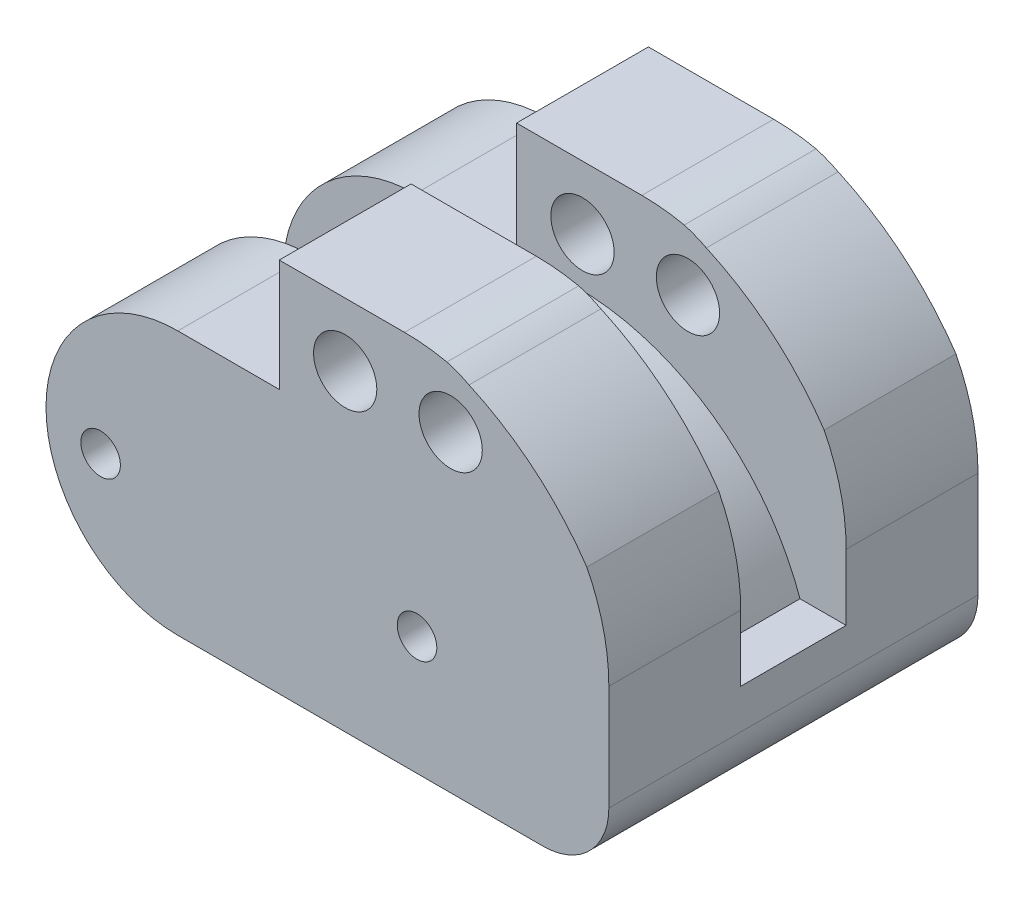
from build123d import *

# Parameters (mm, degrees)
CROQUIS1_W                 = 75
CROQUIS1_H                 = 28
SALIENTE_EXTRUIR2_DEPTH    = 20
CROQUIS2_W                 = 75
CROQUIS2_H                 = 10
SALIENTE_EXTRUIR3_DEPTH    = 8.5
CROQUIS3_R                 = 2.4
CORTAR_EXTRUIR1_DEPTH      = 28
CROQUIS5_W                 = 3.5
CROQUIS5_H                 = 8
CORTAR_EXTRUIR2_DEPTH      = 12
REDONDEO1_R                = 18
CORTAR_EXTRUIR3_DEPTH      = 18.5
CORTAR_EXTRUIR3_DEPTH_BACK = 9.5
CROQUIS7_W                 = 50
CROQUIS7_H                 = 8.5
CROQUIS8_W                 = 50
CROQUIS8_H                 = 9
CORTAR_EXTRUIR4_DEPTH      = 20.5
REDONDEO2_R                = 10
REDONDEO5_R                = 10
CORTAR_EXTRUIR6_DEPTH      = 28.5
CROQUIS10_R                = 1.5
CORTAR_EXTRUIR7_DEPTH      = 85.977938313
REDONDEO6_R                = 10
REDONDEO7_R                = 3
REDONDEO8_R                = 5
CORTAR_EXTRUIR11_DEPTH     = 85.977938313
SALIENTE_EXTRUIR4_DEPTH    = 10
SALIENTE_EXTRUIR5_START    = -10
SALIENTE_EXTRUIR5_DEPTH    = 10
CORTAR_EXTRUIR12_START     = -0.5
CORTAR_EXTRUIR12_DEPTH     = 0.5
CROQUIS20_R                = 1.5
SALIENTE_EXTRUIR7_DEPTH    = 1
CORTAR_EXTRUIR13_DEPTH     = 85.977938313
CORTAR_EXTRUIR14_DEPTH     = 85.977938313
REDONDEO9_R                = 10


with BuildPart() as part:
    # Croquis1 → Saliente-Extruir2 (new body)
    with BuildSketch(Plane(origin=(0, 0, 0), x_dir=(1, 0, 0), z_dir=(0, 1, 0))):
        with Locations((37.5, 14)):
            Rectangle(CROQUIS1_W, CROQUIS1_H)
    extrude(amount=SALIENTE_EXTRUIR2_DEPTH)

    # Croquis2 → Saliente-Extruir3 (add)
    with BuildSketch(Plane(origin=(0, 20, 0), x_dir=(1, 0, 0), z_dir=(0, 1, 0))):
        with Locations((37.5, 5)):
            Rectangle(CROQUIS2_W, CROQUIS2_H)
        with Locations((37.5, 23)):
            Rectangle(CROQUIS2_W, CROQUIS2_H)
    extrude(amount=SALIENTE_EXTRUIR3_DEPTH)

    # Croquis3 → Cortar-Extruir1 (cut)
    with BuildSketch(Plane.XY):
        with Locations((63, 23.7)):
            Circle(CROQUIS3_R)
        with Locations((55, 23.7)):
            Circle(CROQUIS3_R)
    extrude(amount=-CORTAR_EXTRUIR1_DEPTH, mode=Mode.SUBTRACT)

    # Croquis5 → Cortar-Extruir2 (cut)
    with BuildSketch(Plane(origin=(0, 20, 0), x_dir=(1, 0, 0), z_dir=(0, 1, 0))):
        with Locations((73.25, 14)):
            Rectangle(CROQUIS5_W, CROQUIS5_H)
    extrude(amount=-CORTAR_EXTRUIR2_DEPTH, mode=Mode.SUBTRACT)

    # Redondeo1
    # the kernel refuses this fillet: 18 mm, written as the material it takes off along each edge
    with BuildSketch(Plane(origin=(71.5, 20, -10), x_dir=(0, -1, 0), z_dir=(0, 0, -1))) as redondeo1_piece_1:
        with BuildLine():
            CenterArc((18, 16.970562748), REDONDEO1_R, 180, 70.528779366)
            Line((0, 16.970562748), (0, 0))
            Line((0, 0), (12, 0))
        make_face()
    extrude(amount=8, mode=Mode.SUBTRACT)

    # Croquis7 → Cortar-Extruir3 (cut, two sides: drawn at the far end of the back side and taken through both)
    with BuildSketch(Plane.XY.offset(-18).offset(-CORTAR_EXTRUIR3_DEPTH_BACK)):
        with Locations((25, 24.25)):
            Rectangle(CROQUIS7_W, CROQUIS7_H)
    extrude(amount=CORTAR_EXTRUIR3_DEPTH + CORTAR_EXTRUIR3_DEPTH_BACK, mode=Mode.SUBTRACT)

    # Croquis8 → Cortar-Extruir4 (cut)
    with BuildSketch(Plane(origin=(0, 20, 0), x_dir=(1, 0, 0), z_dir=(0, 1, 0))):
        with Locations((25, 14.5)):
            Rectangle(CROQUIS8_W, CROQUIS8_H)
    extrude(amount=-CORTAR_EXTRUIR4_DEPTH, mode=Mode.SUBTRACT)

    # Redondeo2
    redondeo2_edges = [part.edges().sort_by_distance(p)[0] for p in [
        (0, 20, -5),
        (0, 20, -23.25),
    ]]
    fillet(redondeo2_edges, radius=REDONDEO2_R)

    # Redondeo5
    # the kernel refuses this fillet: 10 mm, written as the material it takes off along each edge
    with BuildSketch(Plane(origin=(0, 0, -35), x_dir=(1, 0, 0), z_dir=(0, 0, 1))) as redondeo5_piece_1:
        with BuildLine():
            CenterArc((REDONDEO5_R, REDONDEO5_R), REDONDEO5_R, 180, 90)
            Line((0, REDONDEO5_R), (0, 0))
            Line((0, 0), (REDONDEO5_R, 0))
        make_face()
    extrude(amount=60, mode=Mode.SUBTRACT)

    # Croquis9 → Cortar-Extruir6 (cut)
    with BuildSketch(Plane(origin=(0, 0, -28), x_dir=(-1, 0, 0), z_dir=(0, 0, -1))):
        with BuildLine():
            Line((-75, 28.5), (-59.5, 28.5))
            ThreePointArc((-59.5, 28.5), (-70.460155108, 23.960155108), (-75, 13))
            Line((-75, 13), (-75, 28.5))
        make_face()
    extrude(amount=-CORTAR_EXTRUIR6_DEPTH, mode=Mode.SUBTRACT)

    # Croquis10 → Cortar-Extruir7 (cut, through all)
    with BuildSketch(Plane(origin=(0, 0, -28), x_dir=(-1, 0, 0), z_dir=(0, 0, -1))):
        with Locations((-60.449874371, 9)):
            Circle(CROQUIS10_R)
        with Locations((-36.449874371, 9)):
            Circle(CROQUIS10_R)
        with Locations((-12.449874371, 9)):
            Circle(CROQUIS10_R)
    extrude(amount=-CORTAR_EXTRUIR7_DEPTH, mode=Mode.SUBTRACT)

    # Redondeo6
    redondeo6_edges = [part.edges().sort_by_distance(p)[0] for p in [
        (50, 0, -14.5),
    ]]
    fillet(redondeo6_edges, radius=REDONDEO6_R)

    # Redondeo7
    # the kernel refuses this fillet: 3 mm, written as the material it takes off along each edge
    with BuildSketch(Plane(origin=(50, 20, -18), x_dir=(0, -1, 0), z_dir=(0, 0, 1))) as redondeo7_piece_1:
        with BuildLine():
            CenterArc((REDONDEO7_R, REDONDEO7_R), REDONDEO7_R, 180, 90)
            Line((0, REDONDEO7_R), (0, 0))
            Line((0, 0), (REDONDEO7_R, 0))
        make_face()
    extrude(amount=8, mode=Mode.SUBTRACT)

    # Redondeo8
    redondeo8_edges = [part.edges().sort_by_distance(p)[0] for p in [
        (75, 0, -14),
    ]]
    fillet(redondeo8_edges, radius=REDONDEO8_R)

    # Croquis16 → Cortar-Extruir11 (cut, through all)
    with BuildSketch(Plane(origin=(0, 0, -28), x_dir=(-1, 0, 0), z_dir=(0, 0, -1))):
        with BuildLine():
            Line((-73.329316686, 20), (-69.329316686, 20))
            ThreePointArc((-69.329316686, 20), (-67.304546525, 25.119348054), (-62.716889054, 28.162507207))
            ThreePointArc((-62.716889054, 28.162507207), (-68.949863148, 25.286174608), (-73.329316686, 20))
        make_face()
    extrude(amount=-CORTAR_EXTRUIR11_DEPTH, mode=Mode.SUBTRACT)

    # Croquis17 → Saliente-Extruir4 (add)
    with BuildSketch(Plane(origin=(0, 0, -28), x_dir=(-1, 0, 0), z_dir=(0, 0, -1))):
        with BuildLine():
            Line((-73.329316686, 20), (-69.329316686, 20))
            ThreePointArc((-69.329316686, 20), (-67.839062436, 24.388682638), (-64.39628475, 27.491693244))
            ThreePointArc((-64.39628475, 27.491693244), (-69.382310449, 24.36530565), (-73.329316686, 20))
        make_face()
    extrude(amount=-SALIENTE_EXTRUIR4_DEPTH)

    # Croquis18 → Saliente-Extruir5 (add)
    with BuildSketch(Plane.XY.offset(SALIENTE_EXTRUIR5_START)):
        with BuildLine():
            ThreePointArc((64.39628475, 27.491693244), (67.839062436, 24.388682638), (69.329316686, 20))
            Line((69.329316686, 20), (73.329316686, 20))
            ThreePointArc((73.329316686, 20), (69.382310449, 24.36530565), (64.39628475, 27.491693244))
        make_face()
    extrude(amount=SALIENTE_EXTRUIR5_DEPTH)

    # Croquis19 → Cortar-Extruir12 (cut)
    with BuildSketch(Plane.XY.offset(-27.5).offset(CORTAR_EXTRUIR12_START)):
        with BuildLine():
            Line((50, 20), (50, 28.5))
            Line((50, 28.5), (0, 28.5))
            Line((0, 28.5), (0, 10))
            ThreePointArc((0, 10), (2.928932188, 17.071067812), (10, 20))
            Line((10, 20), (50, 20))
        make_face()
    extrude(amount=CORTAR_EXTRUIR12_DEPTH, mode=Mode.SUBTRACT)

    # Croquis20 → Saliente-Extruir7 (add)
    with BuildSketch(Plane.XY.offset(-19)):
        with BuildLine():
            Line((50, 20), (50, 10))
            ThreePointArc((50, 10), (52.928932188, 2.928932188), (60, 0))
            Line((60, 0), (10, 0))
            ThreePointArc((10, 0), (0, 10), (10, 20))
            Line((10, 20), (50, 20))
        make_face()
        with Locations(Location((12.449874371, 9, 0), (0, 0, 180))):
            Circle(CROQUIS20_R, mode=Mode.SUBTRACT)
        with Locations(Location((36.449874371, 9, 0), (0, 0, 180))):
            Circle(CROQUIS20_R, mode=Mode.SUBTRACT)
    extrude(amount=SALIENTE_EXTRUIR7_DEPTH)

    # Croquis21 → Cortar-Extruir13 (cut, through all)
    with BuildSketch(Plane.XY):
        with BuildLine():
            Line((10, 20), (36.449874371, 20))
            ThreePointArc((36.449874371, 20), (26.449874371, 10), (36.449874371, 0))
            Line((36.449874371, 0), (10, 0))
            ThreePointArc((10, 0), (0, 10), (10, 20))
        make_face()
    extrude(amount=-CORTAR_EXTRUIR13_DEPTH, mode=Mode.SUBTRACT)

    # Croquis22 → Cortar-Extruir14 (cut, through all)
    with BuildSketch(Plane.XY):
        with BuildLine():
            ThreePointArc((36.449874371, 0), (32.307738747, 10), (36.449874371, 20))
            ThreePointArc((36.449874371, 20), (26.449874371, 10), (36.449874371, 0))
        make_face()
    extrude(amount=-CORTAR_EXTRUIR14_DEPTH, mode=Mode.SUBTRACT)

    # Redondeo9
    # the kernel refuses this fillet: 10 mm, written as the material it takes off along each edge
    with BuildSketch(Plane(origin=(36.449874371, 20, 27.059805007), x_dir=(-0.3826834323650891, -0.9238795325112871, 0), z_dir=(0, 0, -1)), Plane(origin=(36.449874371, 20, 9.059805007), x_dir=(-0.3826834323650891, -0.9238795325112871, 0), z_dir=(0, 0, -1))) as redondeo9_piece_1:
        with BuildLine():
            CenterArc((6.997087679, -9.238795325), REDONDEO9_R, 67.5, 90)
            Line((-2.241707646, -5.411961001), (0, 0))
            ThreePointArc((0, 0), (5.411961001, 1.076505975), (10.823922003, 0))
        make_face()
    extrude(amount=64.119610015, mode=Mode.SUBTRACT)
    with BuildSketch(Plane(origin=(36.449874371, 0, 27.059805007), x_dir=(1, 0, 0), z_dir=(0, 0, -1)), Plane(origin=(36.449874371, 0, 9.059805007), x_dir=(1, 0, 0), z_dir=(0, 0, -1))) as redondeo9_piece_2:
        with BuildLine():
            CenterArc((5.857864376, -10), REDONDEO9_R, 90, 90)
            ThreePointArc((-4.142135624, -10), (-3.065629649, -4.588038999), (0, 0))
            Line((0, 0), (5.857864376, 0))
        make_face()
    extrude(amount=64.119610015, mode=Mode.SUBTRACT)


solid = part.part
